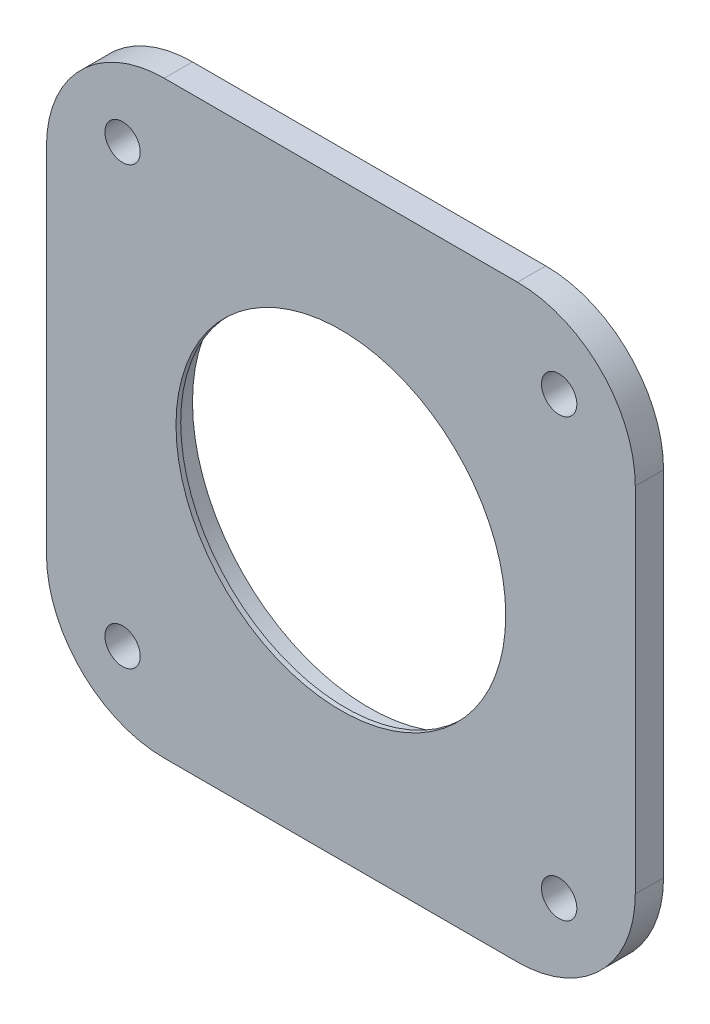
from build123d import *

# Parameters (mm, degrees)
SKETCH1_R           = 19.05
SKETCH1_R_2         = 1.905
BOSS_EXTRUDE1_DEPTH = 3.048
BOSS_EXTRUDE2_START = -0.508
SKETCH2_R           = 19.05
SKETCH2_R_2         = 17.78
BOSS_EXTRUDE2_DEPTH = 0.508


with BuildPart() as part:
    # Sketch1 → Boss-Extrude1 (new body)
    with BuildSketch(Plane.XY):
        with BuildLine():
            Line((-19.05, -31.75), (19.05, -31.75))
            ThreePointArc((19.05, -31.75), (28.030256121, -28.030256121), (31.75, -19.05))
            Line((31.75, -19.05), (31.75, 19.05))
            ThreePointArc((31.75, 19.05), (28.030256121, 28.030256121), (19.05, 31.75))
            Line((19.05, 31.75), (-19.05, 31.75))
            ThreePointArc((-19.05, 31.75), (-28.030256121, 28.030256121), (-31.75, 19.05))
            Line((-31.75, 19.05), (-31.75, -19.05))
            ThreePointArc((-31.75, -19.05), (-28.030256121, -28.030256121), (-19.05, -31.75))
        make_face()
        Circle(SKETCH1_R, mode=Mode.SUBTRACT)
        with Locations((-23.540128061, 23.540128061)):
            Circle(SKETCH1_R_2, mode=Mode.SUBTRACT)
        with Locations((23.540128061, 23.540128061)):
            Circle(SKETCH1_R_2, mode=Mode.SUBTRACT)
        with Locations((23.540128061, -23.540128061)):
            Circle(SKETCH1_R_2, mode=Mode.SUBTRACT)
        with Locations((-23.540128061, -23.540128061)):
            Circle(SKETCH1_R_2, mode=Mode.SUBTRACT)
    extrude(amount=BOSS_EXTRUDE1_DEPTH)

    # Sketch2 → Boss-Extrude2 (add)
    with BuildSketch(Plane.XY.offset(3.048).offset(BOSS_EXTRUDE2_START)):
        Circle(SKETCH2_R)
        Circle(SKETCH2_R_2, mode=Mode.SUBTRACT)
    extrude(amount=BOSS_EXTRUDE2_DEPTH)


solid = part.part
